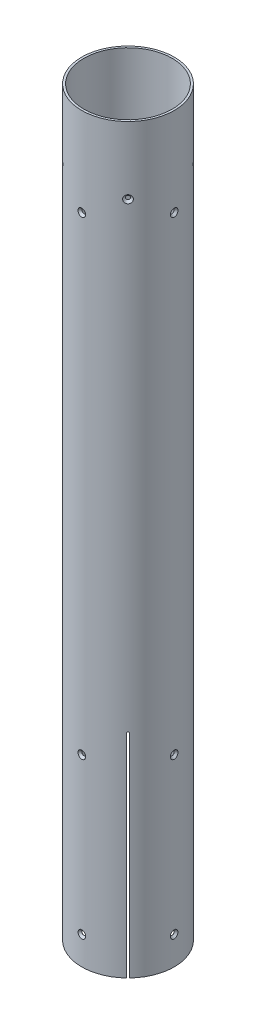
from build123d import *

# Parameters (mm, degrees)
IZIM1_R                                     = 65.5
IZIM1_R_2                                   = 62.5
Y_KSEKLIK_EKSTR_ZYON1_DEPTH                 = 525
M5_ALT_GEN_ALYAN_HAV_A_BA_L_K_R_VID_2_COUNT = 2
M5_ALT_GEN_ALYAN_HAV_A_BA_L_K_R_VID_2_PITCH = 884.74
M5_ALT_GEN_ALYAN_HAV_A_BA_L_K_R_VID_3_COUNT = 2
M5_ALT_GEN_ALYAN_HAV_A_BA_L_K_R_VID_3_PITCH = 664.58
DAIRESEL_KAPLAMA2_COUNT                     = 4
DAIRESEL_KAPLAMA3_COUNT                     = 4
KES_EKSTR_ZYON2_DEPTH                       = 1050
DAIRESEL_KAPLAMA4_COUNT                     = 4


with BuildPart() as part:
    # Çizim1 → Yükseklik-Ekstrüzyon1 (new, symmetric)
    with BuildSketch(Plane(origin=(0, 0, 0), x_dir=(1, 0, 0), z_dir=(0, 1, 0))):
        Circle(IZIM1_R)
        Circle(IZIM1_R_2, mode=Mode.SUBTRACT)
    extrude(amount=Y_KSEKLIK_EKSTR_ZYON1_DEPTH, both=True)

    # Çizim14 → M5 Alt_gen Alyan Hav_a Ba_l_ K_r Vida _i (revolve, cut)
    with BuildSketch(Plane(origin=(65.5, 399.74, 0), x_dir=(0, 0, -1), z_dir=(0, 1, 0))):
        Polygon((0, 0), (0, 16.59228064), (2.65, 15), (2.65, 2.95), (5.6, 0), align=None)
    m5_alt_gen_alyan_hav_a_ba_l_k_r_vida_i = revolve(axis=Axis((71.85, 399.74, 0), (-1, 0, 0)), mode=Mode.SUBTRACT)

    # M5 Alt_gen Alyan Hav_a Ba_l_ K_r Vid 2: M5 Alt_gen Alyan Hav_a Ba_l_ K_r Vida _i ×2
    with Locations(*[(0, -i * M5_ALT_GEN_ALYAN_HAV_A_BA_L_K_R_VID_2_PITCH, 0) for i in range(1, M5_ALT_GEN_ALYAN_HAV_A_BA_L_K_R_VID_2_COUNT)]):
        add(m5_alt_gen_alyan_hav_a_ba_l_k_r_vida_i, mode=Mode.SUBTRACT)

    # M5 Alt_gen Alyan Hav_a Ba_l_ K_r Vid 3: M5 Alt_gen Alyan Hav_a Ba_l_ K_r Vida _i ×2
    with Locations(*[(0, -i * M5_ALT_GEN_ALYAN_HAV_A_BA_L_K_R_VID_3_PITCH, 0) for i in range(1, M5_ALT_GEN_ALYAN_HAV_A_BA_L_K_R_VID_3_COUNT)]):
        add(m5_alt_gen_alyan_hav_a_ba_l_k_r_vida_i, mode=Mode.SUBTRACT)

    # Dairesel Kaplama2: M5 Alt_gen Alyan Hav_a Ba_l_ K_r Vida _i ×4 about axis
    dairesel_kaplama2_axis = Axis((0, 525, 0), (0, 1, 0))
    for i in range(1, DAIRESEL_KAPLAMA2_COUNT):
        add(m5_alt_gen_alyan_hav_a_ba_l_k_r_vida_i.rotate(dairesel_kaplama2_axis, i * 360 / DAIRESEL_KAPLAMA2_COUNT), mode=Mode.SUBTRACT)

    # Dairesel Kaplama2 copy 1 sketch → Dairesel Kaplama2 copy 1 (revolve, cut)
    with BuildSketch(Plane(origin=(0, -485, -65.5), x_dir=(-1, 0, 0), z_dir=(0, 1, 0))):
        Polygon((0, 0), (0, 16.59228064), (2.65, 15), (2.65, 2.95), (5.6, 0), align=None)
    revolve(axis=Axis((0, -485, -71.85), (0, 0, 1)), mode=Mode.SUBTRACT)

    # Dairesel Kaplama2 copy 2 sketch → Dairesel Kaplama2 copy 2 (revolve, cut)
    with BuildSketch(Plane(origin=(-65.5, -485, 0), x_dir=(0, 0, 1), z_dir=(0, 1, 0))):
        Polygon((0, 0), (0, 16.59228064), (2.65, 15), (2.65, 2.95), (5.6, 0), align=None)
    revolve(axis=Axis((-71.85, -485, 0), (1, 0, 0)), mode=Mode.SUBTRACT)

    # Dairesel Kaplama2 copy 3 sketch → Dairesel Kaplama2 copy 3 (revolve, cut)
    with BuildSketch(Plane(origin=(0, -485, 65.5), x_dir=(1, 0, 0), z_dir=(0, 1, 0))):
        Polygon((0, 0), (0, 16.59228064), (2.65, 15), (2.65, 2.95), (5.6, 0), align=None)
    revolve(axis=Axis((0, -485, 71.85), (0, 0, -1)), mode=Mode.SUBTRACT)

    # Dairesel Kaplama2 copy 4 sketch → Dairesel Kaplama2 copy 4 (revolve, cut)
    with BuildSketch(Plane(origin=(0, -264.84, -65.5), x_dir=(-1, 0, 0), z_dir=(0, 1, 0))):
        Polygon((0, 0), (0, 16.59228064), (2.65, 15), (2.65, 2.95), (5.6, 0), align=None)
    revolve(axis=Axis((0, -264.84, -71.85), (0, 0, 1)), mode=Mode.SUBTRACT)

    # Dairesel Kaplama2 copy 5 sketch → Dairesel Kaplama2 copy 5 (revolve, cut)
    with BuildSketch(Plane(origin=(-65.5, -264.84, 0), x_dir=(0, 0, 1), z_dir=(0, 1, 0))):
        Polygon((0, 0), (0, 16.59228064), (2.65, 15), (2.65, 2.95), (5.6, 0), align=None)
    revolve(axis=Axis((-71.85, -264.84, 0), (1, 0, 0)), mode=Mode.SUBTRACT)

    # Dairesel Kaplama2 copy 6 sketch → Dairesel Kaplama2 copy 6 (revolve, cut)
    with BuildSketch(Plane(origin=(0, -264.84, 65.5), x_dir=(1, 0, 0), z_dir=(0, 1, 0))):
        Polygon((0, 0), (0, 16.59228064), (2.65, 15), (2.65, 2.95), (5.6, 0), align=None)
    revolve(axis=Axis((0, -264.84, 71.85), (0, 0, -1)), mode=Mode.SUBTRACT)

    # Çizim18 → M5 Alt_gen Alyan Hav_a Ba_l_ K_r Vid 4 (revolve, cut)
    with BuildSketch(Plane(origin=(46.315494168, 429.7, 46.315494168), x_dir=(0.7071067811865489, 0, -0.7071067811865461), z_dir=(0, 1, 0))):
        Polygon((0, 0), (0, 16.59228064), (2.65, 15), (2.65, 2.95), (5.6, 0), align=None)
    m5_alt_gen_alyan_hav_a_ba_l_k_r_vid_4 = revolve(axis=Axis((50.805622228, 429.7, 50.805622228), (-0.7071067811865461, 0, -0.7071067811865489)), mode=Mode.SUBTRACT)

    # Dairesel Kaplama3: M5 Alt_gen Alyan Hav_a Ba_l_ K_r Vid 4 ×4 about axis
    dairesel_kaplama3_axis = Axis((0, 525, 0), (0, 1, 0))
    for i in range(1, DAIRESEL_KAPLAMA3_COUNT):
        add(m5_alt_gen_alyan_hav_a_ba_l_k_r_vid_4.rotate(dairesel_kaplama3_axis, i * 360 / DAIRESEL_KAPLAMA3_COUNT), mode=Mode.SUBTRACT)

    # Çizim23 → Kes-Ekstrüzyon2 (cut)
    with BuildSketch(Plane(origin=(-22.734595674, 0, 22.734595674), x_dir=(-0.7071067811865465, 0, -0.7071067811865487), z_dir=(0.7071067811865487, 0, -0.7071067811865465))):
        with BuildLine():
            Line((-1.6, -225), (-1.6, -525))
            Line((-1.6, -525), (1.6, -525))
            Line((1.6, -525), (1.6, -225))
            ThreePointArc((1.6, -225), (0, -223.4), (-1.6, -225))
        make_face()
    kes_ekstr_zyon2 = extrude(amount=-KES_EKSTR_ZYON2_DEPTH, mode=Mode.SUBTRACT)

    # Dairesel Kaplama4: Kes-Ekstrüzyon2 ×4 about axis
    dairesel_kaplama4_axis = Axis((0, -525, 0), (0, 1, 0))
    for i in range(1, DAIRESEL_KAPLAMA4_COUNT):
        add(kes_ekstr_zyon2.rotate(dairesel_kaplama4_axis, i * 360 / DAIRESEL_KAPLAMA4_COUNT), mode=Mode.SUBTRACT)


solid = part.part
